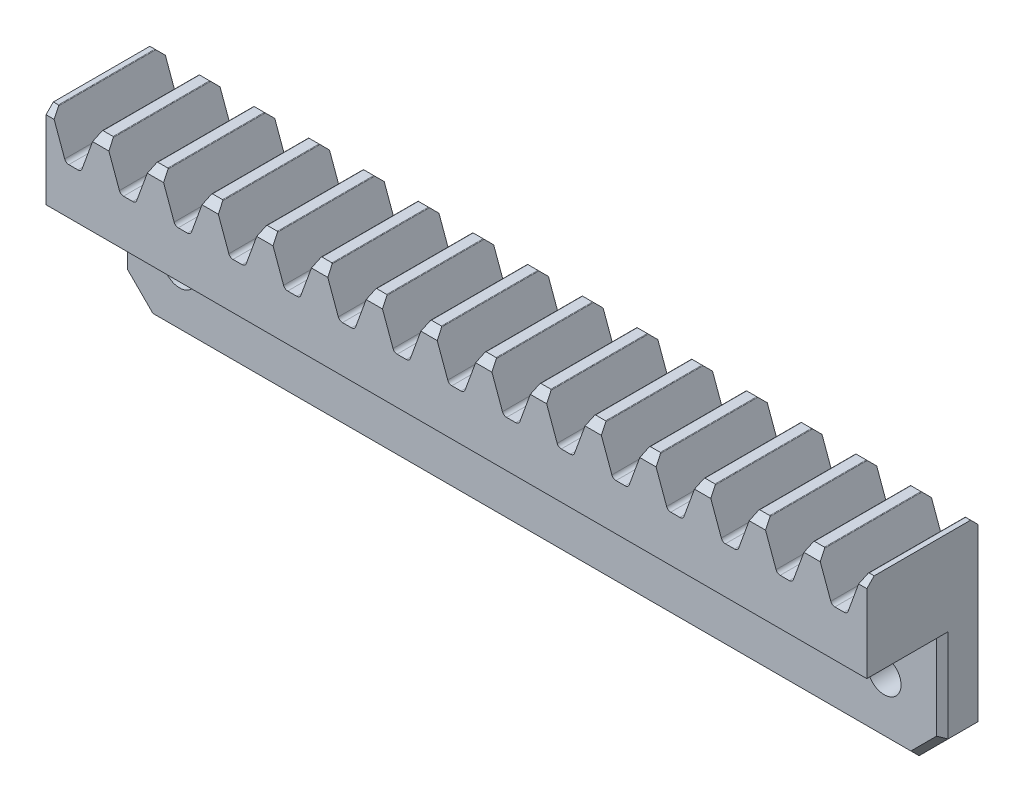
from build123d import *

# Parameters (mm, degrees)
BLANKSKE_W           = 152
BLANKSKE_H           = 15.7
BLANK_DEPTH          = 19.15
CHAMFER1_SIZE        = 1.27
TOOTHCUTILL_DEPTH    = 155.003936638
TEETHCUTS_COUNT      = 17
TEETHCUTS_PITCH      = 9.42477795
SKETCH2_W            = 19.15
SKETCH2_H            = 15.7
CUT_EXTRUDE1_DEPTH   = 4.712389
SKETCH3_W            = 19.15
SKETCH3_H            = 15.7
CUT_EXTRUDE2_DEPTH   = 5.915942
SKETCH7_W            = 141.37166925
SKETCH7_H            = 6.15
BOSS_EXTRUDE1_DEPTH  = 20
M5_CLEARANCE_HOLE1_D = 5.8
CHAMFER3_SIZE        = 5
CHAMFER2_SIZE        = 1


with BuildPart() as part:
    # BlankSke → Blank (new body)
    with BuildSketch(Plane.XY):
        with Locations((76, 7.85)):
            Rectangle(BLANKSKE_W, BLANKSKE_H)
    extrude(amount=-BLANK_DEPTH)

    # Chamfer1
    chamfer1_edges = [part.edges().sort_by_distance(p)[0] for p in [
        (76, 15.7, -19.15),
        (76, 15.7, 0),
    ]]
    chamfer(chamfer1_edges, length=CHAMFER1_SIZE)

    # TooCutSkeIll → ToothCutIll (cut, through all)
    with BuildSketch(Plane.XY):
        with BuildLine():
            Line((-3.74036698, 15.621042417), (-1.492159406, 9.444142872))
            ThreePointArc((-1.492159406, 9.444142872), (-1.217206152, 9.085816815), (-0.786450248, 8.95))
            Line((-0.786450248, 8.95), (0.786450248, 8.95))
            ThreePointArc((0.786450248, 8.95), (1.217206152, 9.085816815), (1.492159406, 9.444142872))
            Line((1.492159406, 9.444142872), (3.74036698, 15.621042417))
            ThreePointArc((3.74036698, 15.621042417), (3.784300923, 15.678298245), (3.853130095, 15.7))
            Line((3.853130095, 15.7), (3.853130095, 15.7254))
            Line((3.853130095, 15.7254), (-3.853130095, 15.7254))
            Line((-3.853130095, 15.7254), (-3.853130095, 15.7))
            ThreePointArc((-3.853130095, 15.7), (-3.784300923, 15.678298245), (-3.74036698, 15.621042417))
        make_face()
    toothcutill = extrude(amount=-TOOTHCUTILL_DEPTH, mode=Mode.SUBTRACT)

    # TeethCuts: ToothCutIll ×17
    with Locations(*[(i * TEETHCUTS_PITCH, 0, 0) for i in range(1, TEETHCUTS_COUNT)]):
        add(toothcutill, mode=Mode.SUBTRACT)

    # Sketch2 → Cut-Extrude1 (cut)
    with BuildSketch(Plane.ZY):
        with Locations((-9.575, 7.85)):
            Rectangle(SKETCH2_W, SKETCH2_H)
    extrude(amount=-CUT_EXTRUDE1_DEPTH, mode=Mode.SUBTRACT)

    # Sketch3 → Cut-Extrude2 (cut)
    with BuildSketch(Plane(origin=(152, 0, 0), x_dir=(0, 0, -1), z_dir=(1, 0, 0))):
        with Locations((9.575, 7.85)):
            Rectangle(SKETCH3_W, SKETCH3_H)
    extrude(amount=-CUT_EXTRUDE2_DEPTH, mode=Mode.SUBTRACT)

    # Sketch7 → Boss-Extrude1 (add)
    with BuildSketch(Plane.XZ):
        with Locations((75.3982236, -16.075)):
            Rectangle(SKETCH7_W, SKETCH7_H)
    extrude(amount=BOSS_EXTRUDE1_DEPTH)

    # M5 Clearance Hole1 (through all)
    with Locations(Plane.XY.offset(-13)):
        with Locations((14.712388975, -10), (136.084058225, -10)):
            Hole(M5_CLEARANCE_HOLE1_D / 2)

    # Chamfer3
    chamfer3_edges = [part.edges().sort_by_distance(p)[0] for p in [
        (146.084058225, -20, -16.075),
        (4.712388975, -20, -16.075),
    ]]
    chamfer(chamfer3_edges, length=CHAMFER3_SIZE)

    # Chamfer2
    # the kernel refuses this chamfer: 1 mm, written as the material it takes off along each edge
    with BuildSketch(Plane(origin=(2.140706012, 0, 0), x_dir=(0, -0.027495876610586372, -0.9996219169112968), z_dir=(1, 0, 0))) as chamfer2_piece_1:
        Polygon((CHAMFER2_SIZE * 0.999621916911, CHAMFER2_SIZE * 0.0274958766106), (-CHAMFER2_SIZE * 0.0274958766106, CHAMFER2_SIZE * 0.999621916911), (0, 0), align=None)
    extrude(amount=146.515034976, mode=Mode.SUBTRACT)
    with BuildSketch(Plane(origin=(146.084058, 0, -13), x_dir=(-0.9996219169112968, -0.027495876610585973, 0), z_dir=(0, 0, 1))) as chamfer2_piece_2:
        Polygon((CHAMFER2_SIZE * 0.999621916911, -CHAMFER2_SIZE * 0.0274958766106), (-CHAMFER2_SIZE * 0.0274958766106, -CHAMFER2_SIZE * 0.999621916911), (0, 0), align=None)
    extrude(amount=15.571682988, mode=Mode.SUBTRACT)
    with BuildSketch(Plane(origin=(4.712389, 0, -13), x_dir=(0.9996219169112968, -0.027495876610586365, 0), z_dir=(0, 0, 1))) as chamfer2_piece_3:
        Polygon((CHAMFER2_SIZE * 0.999621916911, CHAMFER2_SIZE * 0.0274958766106), (-CHAMFER2_SIZE * 0.0274958766106, CHAMFER2_SIZE * 0.999621916911), (0, 0), align=None)
    extrude(amount=15.571682988, mode=Mode.SUBTRACT)
    with BuildSketch(Plane(origin=(7.140706012, -20, -13), x_dir=(0, 0.9996219169112968, 0.027495876610585647), z_dir=(1, 0, 0))) as chamfer2_piece_4:
        Polygon((CHAMFER2_SIZE * 0.999621916911, -CHAMFER2_SIZE * 0.0274958766106), (-CHAMFER2_SIZE * 0.0274958766106, -CHAMFER2_SIZE * 0.999621916911), (0, 0), align=None)
    extrude(amount=136.515035201, mode=Mode.SUBTRACT)
    with BuildSketch(Plane(origin=(4.712388975, 0, -13), x_dir=(0.9996219169015903, 0, 0.027495876963471198), z_dir=(0, -1, 0))) as chamfer2_piece_5:
        Polygon((CHAMFER2_SIZE * 0.999621916902, -CHAMFER2_SIZE * 0.0274958769635), (-CHAMFER2_SIZE * 0.0274958519729, -CHAMFER2_SIZE * 0.999621917589), (0, 0), align=None)
    extrude(amount=17.571682987, mode=Mode.SUBTRACT)
    with BuildSketch(Plane(origin=(146.084058225, 0, -13), x_dir=(-0.9996219169112968, 0, 0.02749587661058574), z_dir=(0, -1, 0))) as chamfer2_piece_6:
        Polygon((CHAMFER2_SIZE * 0.999621916911, CHAMFER2_SIZE * 0.0274958766106), (-CHAMFER2_SIZE * 0.0274958766106, CHAMFER2_SIZE * 0.999621916911), (0, 0), align=None)
    extrude(amount=17.571682988, mode=Mode.SUBTRACT)
    with BuildSketch(Plane(origin=(139.265603745, -21.81845448, -13), x_dir=(-0.7068394360706736, 0.7068394360706736, 0.027495876610585362), z_dir=(0.7071067811865476, 0.7071067811865476, 0))) as chamfer2_piece_7:
        Polygon((CHAMFER2_SIZE * 0.999621916911, -CHAMFER2_SIZE * 0.0274958766106), (-CHAMFER2_SIZE * 0.0274958766106, -CHAMFER2_SIZE * 0.999621916911), (0, 0), align=None)
    extrude(amount=12.214433788, mode=Mode.SUBTRACT)
    with BuildSketch(Plane(origin=(2.893934514, -13.181545514, -13), x_dir=(0.7068394360706735, 0.7068394360706735, 0.027495876610585616), z_dir=(0.7071067811865476, -0.7071067811865475, 0))) as chamfer2_piece_8:
        Polygon((CHAMFER2_SIZE * 0.999621916911, -CHAMFER2_SIZE * 0.0274958766106), (-CHAMFER2_SIZE * 0.0274958766106, -CHAMFER2_SIZE * 0.999621916911), (0, 0), align=None)
    extrude(amount=12.214433797, mode=Mode.SUBTRACT)
    with BuildSketch(Plane(origin=(146.084058225, 2.571682988, -13), x_dir=(-0.9996219169112968, 0, 0.02749587661058574), z_dir=(0, -1, 0))) as chamfer2_piece_9a_section:
        Polygon((CHAMFER2_SIZE * 0.999621916911, CHAMFER2_SIZE * 0.0274958766106), (-CHAMFER2_SIZE * 0.0274958766106, CHAMFER2_SIZE * 0.999621916911), (0, 0), align=None)
    chamfer2_piece_9a = extrude(amount=20.143365976, mode=Mode.PRIVATE)
    chamfer2_piece_9a = split(chamfer2_piece_9a, bisect_by=Plane(origin=(145.754264598, 0, -13.329793627), z_dir=(0, 1, 0)), keep=Keep.TOP, mode=Mode.PRIVATE)
    with BuildSketch(Plane(origin=(146.084058, 0, -15.571682988), x_dir=(-0.9996219169112968, -0.027495876610586483, 0), z_dir=(0, 0, 1))) as chamfer2_piece_9b_section:
        Polygon((CHAMFER2_SIZE * 0.999621916911, -CHAMFER2_SIZE * 0.0274958766106), (-CHAMFER2_SIZE * 0.0274958766106, -CHAMFER2_SIZE * 0.999621916911), (0, 0), align=None)
    chamfer2_piece_9b = extrude(amount=18.143365976, mode=Mode.PRIVATE)
    chamfer2_piece_9b = split(chamfer2_piece_9b, bisect_by=Plane(origin=(145.754264373, 0.329793627, -13), z_dir=(0, 0, -1)), keep=Keep.TOP, mode=Mode.PRIVATE)
    chamfer2_piece_9 = chamfer2_piece_9a & chamfer2_piece_9b
    add(chamfer2_piece_9, mode=Mode.SUBTRACT)
    with BuildSketch(Plane(origin=(4.712389, 2.571682987, -13), x_dir=(0.9996219169112968, 0, 0.027495876610585623), z_dir=(0, -1, 0))) as chamfer2_piece_10a_section:
        Polygon((CHAMFER2_SIZE * 0.999621916911, -CHAMFER2_SIZE * 0.0274958766106), (-CHAMFER2_SIZE * 0.0274958766106, -CHAMFER2_SIZE * 0.999621916911), (0, 0), align=None)
    chamfer2_piece_10a = extrude(amount=20.143365974, mode=Mode.PRIVATE)
    chamfer2_piece_10a = split(chamfer2_piece_10a, bisect_by=Plane(origin=(5.042182627, 0, -13.329793627), z_dir=(0, 1, 0)), keep=Keep.TOP, mode=Mode.PRIVATE)
    with BuildSketch(Plane(origin=(4.712389, 0, -15.571682988), x_dir=(0.9996219169112968, -0.027495876610586365, 0), z_dir=(0, 0, 1))) as chamfer2_piece_10b_section:
        Polygon((CHAMFER2_SIZE * 0.999621916911, CHAMFER2_SIZE * 0.0274958766106), (-CHAMFER2_SIZE * 0.0274958766106, CHAMFER2_SIZE * 0.999621916911), (0, 0), align=None)
    chamfer2_piece_10b = extrude(amount=18.143365976, mode=Mode.PRIVATE)
    chamfer2_piece_10b = split(chamfer2_piece_10b, bisect_by=Plane(origin=(5.042182627, 0.329793627, -13), z_dir=(0, 0, -1)), keep=Keep.TOP, mode=Mode.PRIVATE)
    chamfer2_piece_10 = chamfer2_piece_10a & chamfer2_piece_10b
    add(chamfer2_piece_10, mode=Mode.SUBTRACT)


solid = part.part
